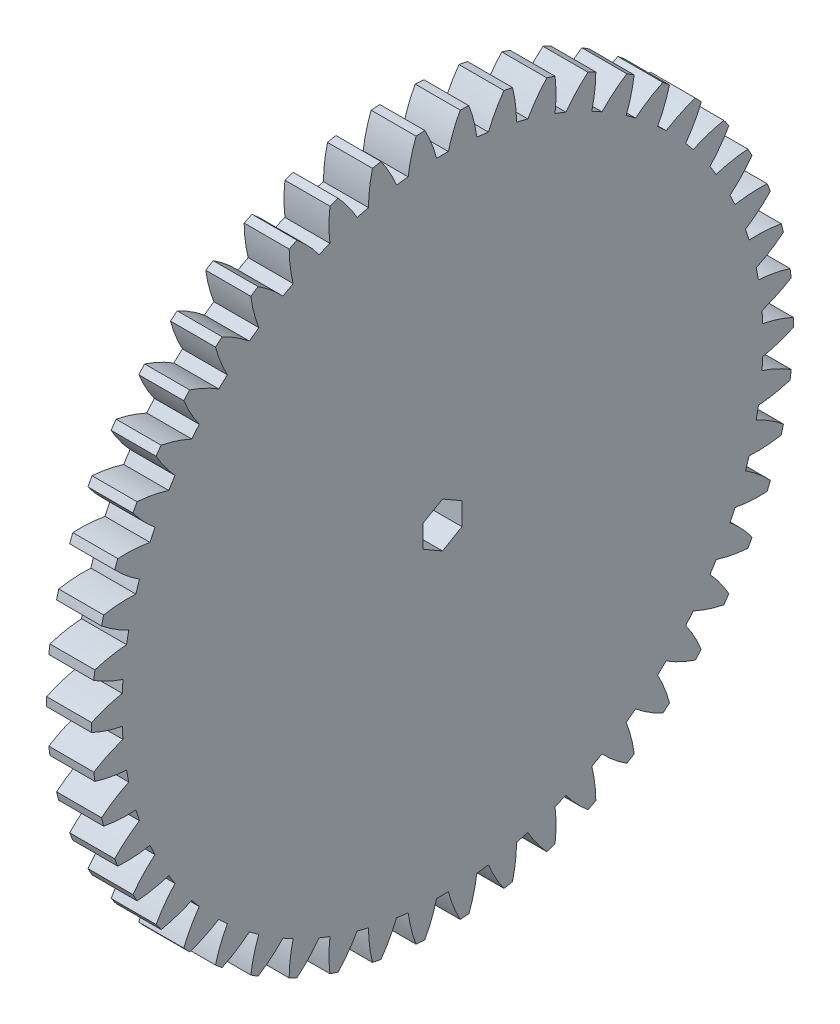
from build123d import *

# Parameters (mm, degrees)
BASPROSKE_W         = 5
BASPROSKE_H         = 39
TOOTHCUT_DEPTH      = 56.380501984
TEETHCUTS_COUNT     = 50
TEETHCUTS_ANGLE     = 352.8
BORE_DEPTH          = 50.0000508
BOSS_EXTRUDE1_DEPTH = 10


with BuildPart() as part:
    # BasProSke → Base-Revolve (revolve)
    with BuildSketch(Plane(origin=(0, 0, 0), x_dir=(1, 0, 0), z_dir=(0, 1, 0))):
        with Locations((2.5, 19.5)):
            Rectangle(BASPROSKE_W, BASPROSKE_H)
    revolve(axis=Axis((-10, 0, 0), (1, 0, 0)))

    # TooCutSke → ToothCut (cut, through all)
    with BuildSketch(Plane(origin=(0, 0, 0), x_dir=(0, 0, -1), z_dir=(1, 0, 0))):
        with BuildLine():
            ThreePointArc((0.649974317, 35.618069984), (0, 35.624), (-0.649974317, 35.618069984))
            ThreePointArc((-0.649974317, 35.618069984), (-1.213667282, 37.336773563), (-1.980135572, 38.975131921))
            ThreePointArc((-1.980135572, 38.975131921), (0, 39.0254), (1.980135572, 38.975131921))
            ThreePointArc((1.980135572, 38.975131921), (1.213667282, 37.336773563), (0.649974317, 35.618069984))
        make_face()
    toothcut = extrude(amount=TOOTHCUT_DEPTH, mode=Mode.SUBTRACT)

    # TeethCuts: ToothCut ×50 about axis
    teethcuts_axis = Axis((-10, 0, 0), (1, 0, 0))
    for i in range(1, TEETHCUTS_COUNT):
        add(toothcut.rotate(teethcuts_axis, i * TEETHCUTS_ANGLE / (TEETHCUTS_COUNT - 1)), mode=Mode.SUBTRACT)

    # BorSke → Bore (cut, symmetric)
    with BuildSketch(Plane(origin=(0, 0, 0), x_dir=(0, 0, -1), z_dir=(1, 0, 0))):
        Polygon((0, -2.5), (2.165063509, -1.25), (2.165063509, 1.25), (0, 2.5), (-2.165063509, 1.25), (-2.165063509, -1.25), align=None)
    extrude(amount=BORE_DEPTH, both=True, mode=Mode.SUBTRACT)

    # Sketch1 → Boss-Extrude1 (add)
    with BuildSketch(Plane.ZY):
        with BuildLine():
            ThreePointArc((0.186825145, -8.9980607), (1.087459567, -7.388027907), (0.875696034, -5.555405697))
            ThreePointArc((0.875696034, -5.555405697), (1.737911579, -5.348741847), (2.556932571, -5.009138831))
            ThreePointArc((2.556932571, -5.009138831), (3.462800583, -6.616232824), (5.137782668, -7.389397083))
            ThreePointArc((5.137782668, -7.389397083), (5.290067274, -7.281152947), (5.440072096, -7.169770958))
            ThreePointArc((5.440072096, -7.169770958), (5.222347117, -5.337847436), (3.973838512, -3.979696405))
            ThreePointArc((3.973838512, -3.979696405), (4.549911578, -3.305704257), (5.012899835, -2.549551185))
            ThreePointArc((5.012899835, -2.549551185), (6.690388599, -3.317261679), (8.499932121, -2.958234937))
            ThreePointArc((8.499932121, -2.958234937), (8.559508648, -2.781152945), (8.615396408, -2.602872401))
            ThreePointArc((8.615396408, -2.602872401), (7.36247557, -1.248790671), (5.554109745, -0.883878352))
            ThreePointArc((5.554109745, -0.883878352), (5.624, 3e-09), (5.554109744, 0.883878357))
            ThreePointArc((5.554109744, 0.883878357), (7.362475569, 1.248790678), (8.615396405, 2.602872409))
            ThreePointArc((8.615396405, 2.602872409), (8.559508645, 2.781152953), (8.499932118, 2.958234945))
            ThreePointArc((8.499932118, 2.958234945), (6.690388596, 3.317261685), (5.012899832, 2.54955119))
            ThreePointArc((5.012899832, 2.54955119), (4.549911575, 3.305704261), (3.973838508, 3.979696409))
            ThreePointArc((3.973838508, 3.979696409), (5.222347112, 5.33784744), (5.44007209, 7.169770963))
            ThreePointArc((5.44007209, 7.169770963), (5.290067267, 7.281152952), (5.137782661, 7.389397088))
            ThreePointArc((5.137782661, 7.389397088), (3.462800577, 6.616232827), (2.556932566, 5.009138833))
            ThreePointArc((2.556932566, 5.009138833), (1.737911574, 5.348741848), (0.875696028, 5.555405698))
            ThreePointArc((0.875696028, 5.555405698), (1.08745956, 7.388027908), (0.186825137, 8.9980607))
            ThreePointArc((0.186825137, 8.9980607), (-4e-09, 9), (-0.186825145, 8.9980607))
            ThreePointArc((-0.186825145, 8.9980607), (-1.087459567, 7.388027907), (-0.875696034, 5.555405697))
            ThreePointArc((-0.875696034, 5.555405697), (-1.737911579, 5.348741847), (-2.556932571, 5.009138831))
            ThreePointArc((-2.556932571, 5.009138831), (-3.462800583, 6.616232824), (-5.137782668, 7.389397083))
            ThreePointArc((-5.137782668, 7.389397083), (-5.290067274, 7.281152947), (-5.440072096, 7.169770958))
            ThreePointArc((-5.440072096, 7.169770958), (-5.222347117, 5.337847436), (-3.973838512, 3.979696405))
            ThreePointArc((-3.973838512, 3.979696405), (-4.549911578, 3.305704257), (-5.012899835, 2.549551185))
            ThreePointArc((-5.012899835, 2.549551185), (-6.690388599, 3.317261679), (-8.499932121, 2.958234937))
            ThreePointArc((-8.499932121, 2.958234937), (-8.559508648, 2.781152945), (-8.615396408, 2.602872401))
            ThreePointArc((-8.615396408, 2.602872401), (-7.36247557, 1.248790671), (-5.554109745, 0.883878352))
            ThreePointArc((-5.554109745, 0.883878352), (-5.624, -3e-09), (-5.554109744, -0.883878357))
            ThreePointArc((-5.554109744, -0.883878357), (-7.362475569, -1.248790678), (-8.615396405, -2.602872409))
            ThreePointArc((-8.615396405, -2.602872409), (-8.559508645, -2.781152953), (-8.499932118, -2.958234945))
            ThreePointArc((-8.499932118, -2.958234945), (-6.690388596, -3.317261685), (-5.012899832, -2.54955119))
            ThreePointArc((-5.012899832, -2.54955119), (-4.549911575, -3.305704261), (-3.973838508, -3.979696409))
            ThreePointArc((-3.973838508, -3.979696409), (-5.222347112, -5.33784744), (-5.44007209, -7.169770963))
            ThreePointArc((-5.44007209, -7.169770963), (-5.290067267, -7.281152952), (-5.137782661, -7.389397088))
            ThreePointArc((-5.137782661, -7.389397088), (-3.462800577, -6.616232827), (-2.556932566, -5.009138833))
            ThreePointArc((-2.556932566, -5.009138833), (-1.737911574, -5.348741848), (-0.875696028, -5.555405698))
            ThreePointArc((-0.875696028, -5.555405698), (-1.08745956, -7.388027908), (-0.186825137, -8.9980607))
            ThreePointArc((-0.186825137, -8.9980607), (4e-09, -9), (0.186825145, -8.9980607))
        make_face()
        Polygon((2.165063509, -1.25), (2.165063509, 1.25), (0, 2.5), (-2.165063509, 1.25), (-2.165063509, -1.25), (0, -2.5), align=None, mode=Mode.SUBTRACT)
    extrude(amount=BOSS_EXTRUDE1_DEPTH)


solid = part.part
